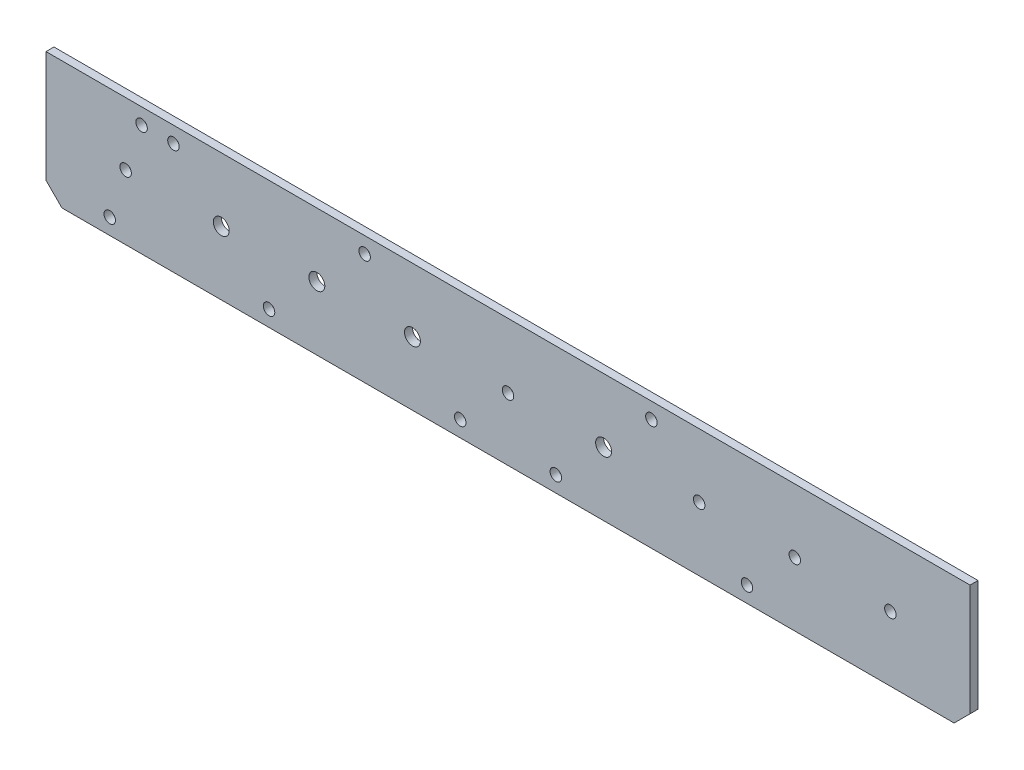
from build123d import *

# Parameters (mm, degrees)
SKETCH1_W           = 368.3
SKETCH1_H           = 50.8
BOSS_EXTRUDE1_DEPTH = 3.175
CUT_EXTRUDE1_REACH  = 373.8
SKETCH2_R           = 2.286
SKETCH2_R_2         = 3.175


with BuildPart() as part:
    # Sketch1 → Boss-Extrude1 (new body)
    with BuildSketch(Plane.XY):
        with Locations((184.15, 25.4)):
            Rectangle(SKETCH1_W, SKETCH1_H)
    extrude(amount=BOSS_EXTRUDE1_DEPTH)

    # Sketch2 → Cut-Extrude1 (cut, up to next)
    with BuildSketch(Plane.XY.offset(3.175), mode=Mode.PRIVATE) as cut_extrude1_sk1:
        with Locations((31.75, 25.796875)):
            Circle(SKETCH2_R)
    cut_extrude1_tool1 = extrude(cut_extrude1_sk1.sketch, amount=-CUT_EXTRUDE1_REACH, mode=Mode.PRIVATE) & part.part
    # Sketch2 → Cut-Extrude1 (cut, up to next)
    with BuildSketch(Plane.XY.offset(3.175), mode=Mode.PRIVATE) as cut_extrude1_sk2:
        with Locations((184.15, 25.003125)):
            Circle(SKETCH2_R)
    cut_extrude1_tool2 = extrude(cut_extrude1_sk2.sketch, amount=-CUT_EXTRUDE1_REACH, mode=Mode.PRIVATE) & part.part
    # Sketch2 → Cut-Extrude1 (cut, up to next)
    with BuildSketch(Plane.XY.offset(3.175), mode=Mode.PRIVATE) as cut_extrude1_sk3:
        with Locations((107.95, 25.4)):
            Circle(SKETCH2_R_2)
    cut_extrude1_tool3 = extrude(cut_extrude1_sk3.sketch, amount=-CUT_EXTRUDE1_REACH, mode=Mode.PRIVATE) & part.part
    # Sketch2 → Cut-Extrude1 (cut, up to next)
    with BuildSketch(Plane.XY.offset(3.175), mode=Mode.PRIVATE) as cut_extrude1_sk4:
        with Locations((69.85, 25.4)):
            Circle(SKETCH2_R_2)
    cut_extrude1_tool4 = extrude(cut_extrude1_sk4.sketch, amount=-CUT_EXTRUDE1_REACH, mode=Mode.PRIVATE) & part.part
    # Sketch2 → Cut-Extrude1 (cut, up to next)
    with BuildSketch(Plane.XY.offset(3.175), mode=Mode.PRIVATE) as cut_extrude1_sk5:
        with Locations((146.05, 25.4)):
            Circle(SKETCH2_R_2)
    cut_extrude1_tool5 = extrude(cut_extrude1_sk5.sketch, amount=-CUT_EXTRUDE1_REACH, mode=Mode.PRIVATE) & part.part
    # Sketch2 → Cut-Extrude1 (cut, up to next)
    with BuildSketch(Plane.XY.offset(3.175), mode=Mode.PRIVATE) as cut_extrude1_sk6:
        with Locations((222.25, 25.4)):
            Circle(SKETCH2_R_2)
    cut_extrude1_tool6 = extrude(cut_extrude1_sk6.sketch, amount=-CUT_EXTRUDE1_REACH, mode=Mode.PRIVATE) & part.part
    # Sketch2 → Cut-Extrude1 (cut, up to next)
    with BuildSketch(Plane.XY.offset(3.175), mode=Mode.PRIVATE) as cut_extrude1_sk7:
        with Locations((298.45, 25.4)):
            Circle(SKETCH2_R)
    cut_extrude1_tool7 = extrude(cut_extrude1_sk7.sketch, amount=-CUT_EXTRUDE1_REACH, mode=Mode.PRIVATE) & part.part
    # Sketch2 → Cut-Extrude1 (cut, up to next)
    with BuildSketch(Plane.XY.offset(3.175), mode=Mode.PRIVATE) as cut_extrude1_sk8:
        with Locations((260.35, 25.4)):
            Circle(SKETCH2_R)
    cut_extrude1_tool8 = extrude(cut_extrude1_sk8.sketch, amount=-CUT_EXTRUDE1_REACH, mode=Mode.PRIVATE) & part.part
    # Sketch2 → Cut-Extrude1 (cut, up to next)
    with BuildSketch(Plane.XY.offset(3.175), mode=Mode.PRIVATE) as cut_extrude1_sk9:
        with Locations((336.55, 25.796875)):
            Circle(SKETCH2_R)
    cut_extrude1_tool9 = extrude(cut_extrude1_sk9.sketch, amount=-CUT_EXTRUDE1_REACH, mode=Mode.PRIVATE) & part.part
    # Sketch2 → Cut-Extrude1 (cut, up to next)
    with BuildSketch(Plane.XY.offset(3.175), mode=Mode.PRIVATE) as cut_extrude1_sk10:
        with Locations((50.8, 44.45)):
            Circle(SKETCH2_R)
    cut_extrude1_tool10 = extrude(cut_extrude1_sk10.sketch, amount=-CUT_EXTRUDE1_REACH, mode=Mode.PRIVATE) & part.part
    # Sketch2 → Cut-Extrude1 (cut, up to next)
    with BuildSketch(Plane.XY.offset(3.175), mode=Mode.PRIVATE) as cut_extrude1_sk11:
        with Locations((165.1, 6.35)):
            Circle(SKETCH2_R)
    cut_extrude1_tool11 = extrude(cut_extrude1_sk11.sketch, amount=-CUT_EXTRUDE1_REACH, mode=Mode.PRIVATE) & part.part
    # Sketch2 → Cut-Extrude1 (cut, up to next)
    with BuildSketch(Plane.XY.offset(3.175), mode=Mode.PRIVATE) as cut_extrude1_sk12:
        with Locations((203.2, 6.35)):
            Circle(SKETCH2_R)
    cut_extrude1_tool12 = extrude(cut_extrude1_sk12.sketch, amount=-CUT_EXTRUDE1_REACH, mode=Mode.PRIVATE) & part.part
    # Sketch2 → Cut-Extrude1 (cut, up to next)
    with BuildSketch(Plane.XY.offset(3.175), mode=Mode.PRIVATE) as cut_extrude1_sk13:
        with Locations((127, 44.45)):
            Circle(SKETCH2_R)
    cut_extrude1_tool13 = extrude(cut_extrude1_sk13.sketch, amount=-CUT_EXTRUDE1_REACH, mode=Mode.PRIVATE) & part.part
    # Sketch2 → Cut-Extrude1 (cut, up to next)
    with BuildSketch(Plane.XY.offset(3.175), mode=Mode.PRIVATE) as cut_extrude1_sk14:
        with Locations((241.3, 44.45)):
            Circle(SKETCH2_R)
    cut_extrude1_tool14 = extrude(cut_extrude1_sk14.sketch, amount=-CUT_EXTRUDE1_REACH, mode=Mode.PRIVATE) & part.part
    # Sketch2 → Cut-Extrude1 (cut, up to next)
    with BuildSketch(Plane.XY.offset(3.175), mode=Mode.PRIVATE) as cut_extrude1_sk15:
        with Locations((88.9, 6.35)):
            Circle(SKETCH2_R)
    cut_extrude1_tool15 = extrude(cut_extrude1_sk15.sketch, amount=-CUT_EXTRUDE1_REACH, mode=Mode.PRIVATE) & part.part
    # Sketch2 → Cut-Extrude1 (cut, up to next)
    with BuildSketch(Plane.XY.offset(3.175), mode=Mode.PRIVATE) as cut_extrude1_sk16:
        with Locations((279.4, 6.35)):
            Circle(SKETCH2_R)
    cut_extrude1_tool16 = extrude(cut_extrude1_sk16.sketch, amount=-CUT_EXTRUDE1_REACH, mode=Mode.PRIVATE) & part.part
    # Sketch2 → Cut-Extrude1 (cut, up to next)
    with BuildSketch(Plane.XY.offset(3.175), mode=Mode.PRIVATE) as cut_extrude1_sk17:
        with Locations((38.1, 44.45)):
            Circle(SKETCH2_R)
    cut_extrude1_tool17 = extrude(cut_extrude1_sk17.sketch, amount=-CUT_EXTRUDE1_REACH, mode=Mode.PRIVATE) & part.part
    # Sketch2 → Cut-Extrude1 (cut, up to next)
    with BuildSketch(Plane.XY.offset(3.175), mode=Mode.PRIVATE) as cut_extrude1_sk18:
        with Locations((25.4, 6.35)):
            Circle(SKETCH2_R)
    cut_extrude1_tool18 = extrude(cut_extrude1_sk18.sketch, amount=-CUT_EXTRUDE1_REACH, mode=Mode.PRIVATE) & part.part
    # Sketch2 → Cut-Extrude1 (cut, up to next)
    with BuildSketch(Plane.XY.offset(3.175), mode=Mode.PRIVATE) as cut_extrude1_sk19:
        Polygon((0, 6.35), (0, 0), (6.35, 0), align=None)
    cut_extrude1_tool19 = extrude(cut_extrude1_sk19.sketch, amount=-CUT_EXTRUDE1_REACH, mode=Mode.PRIVATE) & part.part
    # Sketch2 → Cut-Extrude1 (cut, up to next)
    with BuildSketch(Plane.XY.offset(3.175), mode=Mode.PRIVATE) as cut_extrude1_sk20:
        Polygon((368.3, 0), (361.95, 0), (368.3, 6.35), align=None)
    cut_extrude1_tool20 = extrude(cut_extrude1_sk20.sketch, amount=-CUT_EXTRUDE1_REACH, mode=Mode.PRIVATE) & part.part
    add(cut_extrude1_tool1.solids().sort_by_distance((31.75, 25.796875, 3.175))[0], mode=Mode.SUBTRACT)
    add(cut_extrude1_tool2.solids().sort_by_distance((184.15, 25.003125, 3.175))[0], mode=Mode.SUBTRACT)
    add(cut_extrude1_tool3.solids().sort_by_distance((107.95, 25.4, 3.175))[0], mode=Mode.SUBTRACT)
    add(cut_extrude1_tool4.solids().sort_by_distance((69.85, 25.4, 3.175))[0], mode=Mode.SUBTRACT)
    add(cut_extrude1_tool5.solids().sort_by_distance((146.05, 25.4, 3.175))[0], mode=Mode.SUBTRACT)
    add(cut_extrude1_tool6.solids().sort_by_distance((222.25, 25.4, 3.175))[0], mode=Mode.SUBTRACT)
    add(cut_extrude1_tool7.solids().sort_by_distance((298.45, 25.4, 3.175))[0], mode=Mode.SUBTRACT)
    add(cut_extrude1_tool8.solids().sort_by_distance((260.35, 25.4, 3.175))[0], mode=Mode.SUBTRACT)
    add(cut_extrude1_tool9.solids().sort_by_distance((336.55, 25.796875, 3.175))[0], mode=Mode.SUBTRACT)
    add(cut_extrude1_tool10.solids().sort_by_distance((50.8, 44.45, 3.175))[0], mode=Mode.SUBTRACT)
    add(cut_extrude1_tool11.solids().sort_by_distance((165.1, 6.35, 3.175))[0], mode=Mode.SUBTRACT)
    add(cut_extrude1_tool12.solids().sort_by_distance((203.2, 6.35, 3.175))[0], mode=Mode.SUBTRACT)
    add(cut_extrude1_tool13.solids().sort_by_distance((127, 44.45, 3.175))[0], mode=Mode.SUBTRACT)
    add(cut_extrude1_tool14.solids().sort_by_distance((241.3, 44.45, 3.175))[0], mode=Mode.SUBTRACT)
    add(cut_extrude1_tool15.solids().sort_by_distance((88.9, 6.35, 3.175))[0], mode=Mode.SUBTRACT)
    add(cut_extrude1_tool16.solids().sort_by_distance((279.4, 6.35, 3.175))[0], mode=Mode.SUBTRACT)
    add(cut_extrude1_tool17.solids().sort_by_distance((38.1, 44.45, 3.175))[0], mode=Mode.SUBTRACT)
    add(cut_extrude1_tool18.solids().sort_by_distance((25.4, 6.35, 3.175))[0], mode=Mode.SUBTRACT)
    add(cut_extrude1_tool19.solids().sort_by_distance((2.116667, 2.116667, 3.175))[0], mode=Mode.SUBTRACT)
    add(cut_extrude1_tool20.solids().sort_by_distance((366.183333, 2.116667, 3.175))[0], mode=Mode.SUBTRACT)


solid = part.part
